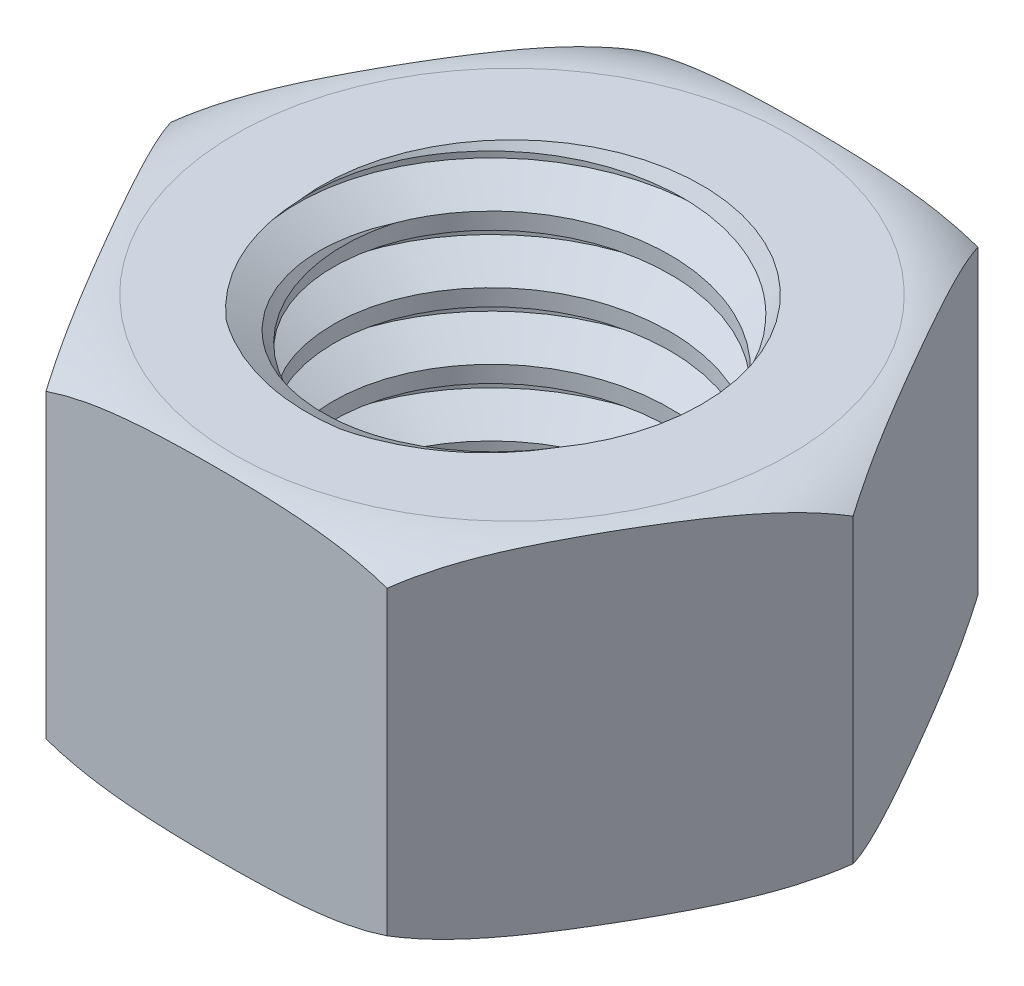
from build123d import *
from OCP.BRepFilletAPI import BRepFilletAPI_MakeChamfer

# Parameters (mm, degrees)
SKETCH1_R           = 4.03225
BOSS_EXTRUDE1_DEPTH = 4.10845
CHAMFER2_SIZE       = 0.508
CHAMFER2_SIZE2      = 0.997006137
THREAD2_PITCH       = 1.5875


with BuildPart() as part:
    # Sketch1 → Boss-Extrude1 (new, symmetric)
    with BuildSketch(Plane(origin=(0, 0, 0), x_dir=(1, 0, 0), z_dir=(0, 1, 0))):
        Polygon((8.16090379, 0), (4.080451895, 7.06755), (-4.080451895, 7.06755), (-8.16090379, 0), (-4.080451895, -7.06755), (4.080451895, -7.06755), align=None)
        with Locations(Location((0, 0, 0), (0, 0, 270))):
            Circle(SKETCH1_R, mode=Mode.SUBTRACT)
    extrude(amount=BOSS_EXTRUDE1_DEPTH, both=True)

    # Sketch2 → Cut-Revolve2 (revolve, cut)
    with BuildSketch(Plane.XY, mode=Mode.PRIVATE) as cut_revolve2_sk:
        with BuildLine():
            Line((8.16090379, 4.10845), (6.63690379, 4.10845))
            ThreePointArc((6.63690379, 4.10845), (7.435574067, 3.964460831), (8.16090379, 3.60045))
            Line((8.16090379, 3.60045), (8.16090379, 4.10845))
        make_face()
        with BuildLine():
            Line((8.16090379, -4.10845), (8.16090379, -3.60045))
            ThreePointArc((8.16090379, -3.60045), (7.435574067, -3.964460831), (6.63690379, -4.10845))
            Line((6.63690379, -4.10845), (8.16090379, -4.10845))
        make_face()
    revolve(cut_revolve2_sk.sketch.rotate(Axis((0, 4.10845, 0), (0, -1, 0)), 90), axis=Axis((0, 4.10845, 0), (0, -1, 0)), mode=Mode.SUBTRACT)

    # Chamfer2: one chamfer whose edges measure the first distance from different faces: ONE call of the kernel's chamfer builder (chamfer() names one face for all edges)
    chamfer2_edges_1 = [part.edges().sort_by_distance(p)[0] for p in [
        (0, -4.10845, -4.03225),
    ]]
    chamfer2_side_1 = [part.faces().sort_by_distance(p)[0] for p in [
        (0, 0, -4.03225),
    ]]
    chamfer2_edges_2 = [part.edges().sort_by_distance(p)[0] for p in [
        (0, 4.10845, -4.03225),
    ]]
    chamfer2_side_2 = [part.faces().sort_by_distance(p)[0] for p in [
        (0, 4.10845, -6.449183803),
    ]]
    chamfer2 = BRepFilletAPI_MakeChamfer(part.part.solid().wrapped)
    for e in chamfer2_edges_1:
        chamfer2.Add(CHAMFER2_SIZE, CHAMFER2_SIZE2, e.wrapped, chamfer2_side_1[0].wrapped)  # the first distance lies on this face
    for e in chamfer2_edges_2:
        chamfer2.Add(CHAMFER2_SIZE, CHAMFER2_SIZE2, e.wrapped, chamfer2_side_2[0].wrapped)  # the first distance lies on this face
    add(Compound.cast(chamfer2.Shape()), mode=Mode.REPLACE)

    # Thread2: the profile of Thread Profile2 profile screwed along a right-hand helix of 9.499213 turns, 8 arcs to a turn; built about Z, then put on its axis
    thread2_z = Axis((0, 0, 0), (0, 0, 1))
    thread2_corners = [(4.03195, 0, -0.000173205), (4.891509577, 0, 0.496093748), (4.891509577, 0, 0.694531248), (4.03195, 0, 1.190798201)]
    with BuildLine(mode=Mode.PRIVATE) as thread2_profile:
        Line(thread2_corners[0], thread2_corners[1])
        Line(thread2_corners[1], thread2_corners[2])
        Line(thread2_corners[2], thread2_corners[3])
        Line(thread2_corners[3], thread2_corners[0])
    thread2_cap = Face(thread2_profile.wire())
    thread2_turn_angles = [0, 22.5, 45, 67.5, 90, 112.5, 135, 157.5, 180, 202.5, 225, 247.5, 270, 292.5, 315, 337.5, 360]
    thread2_turn_weights = [1, 0.9238795325112867, 1, 0.9238795325112867, 1, 0.9238795325112867, 1, 0.9238795325112867, 1, 0.9238795325112867, 1, 0.9238795325112867, 1, 0.9238795325112867, 1, 0.9238795325112867, 1]
    thread2_turn_rails = [Edge.make_bspline([Vector(p[0], p[1], 0).rotate(thread2_z, thread2_turn_angles[k]) / thread2_turn_weights[k] + Vector(0, 0, p[2] + THREAD2_PITCH * thread2_turn_angles[k] / 360) for k in range(17)], [0, 0, 0, 1, 1, 2, 2, 3, 3, 4, 4, 5, 5, 6, 6, 7, 7, 8, 8, 8], 2, thread2_turn_weights) for p in thread2_corners]
    thread2_turn_sides = [Face.make_surface_from_curves(thread2_turn_rails[p[0]], thread2_turn_rails[p[1]]) for p in [(0, 1), (1, 2), (2, 3), (3, 0)]]
    thread2_last_angles = [3240, 3262.5, 3285, 3307.5, 3330, 3352.5, 3375, 3397.358267717, 3419.716535433]
    thread2_last_weights = [1, 0.9238795325112867, 1, 0.9238795325112867, 1, 0.9238795325112867, 1, 0.9248233469550309, 1]
    thread2_last_rails = [Edge.make_bspline([Vector(p[0], p[1], 0).rotate(thread2_z, thread2_last_angles[k]) / thread2_last_weights[k] + Vector(0, 0, p[2] + THREAD2_PITCH * thread2_last_angles[k] / 360) for k in range(9)], [0, 0, 0, 1, 1, 2, 2, 3, 3, 4, 4, 4], 2, thread2_last_weights) for p in thread2_corners]
    thread2_last_sides = [Face.make_surface_from_curves(thread2_last_rails[p[0]], thread2_last_rails[p[1]]) for p in [(0, 1), (1, 2), (2, 3), (3, 0)]]
    thread2 = Plane(origin=(0, -7.14045, 0), x_dir=(1, 0, 0), z_dir=(0, 1, 0)) * Solid(Shell([*[p.moved(Location((0, 0, THREAD2_PITCH * i))) for i in range(9) for p in thread2_turn_sides], *thread2_last_sides, thread2_cap, thread2_cap.rotate(thread2_z, 3419.716535433).moved(Location((0, 0, THREAD2_PITCH * 3419.716535433 / 360)))]))
    add(thread2, mode=Mode.SUBTRACT)


solid = part.part
